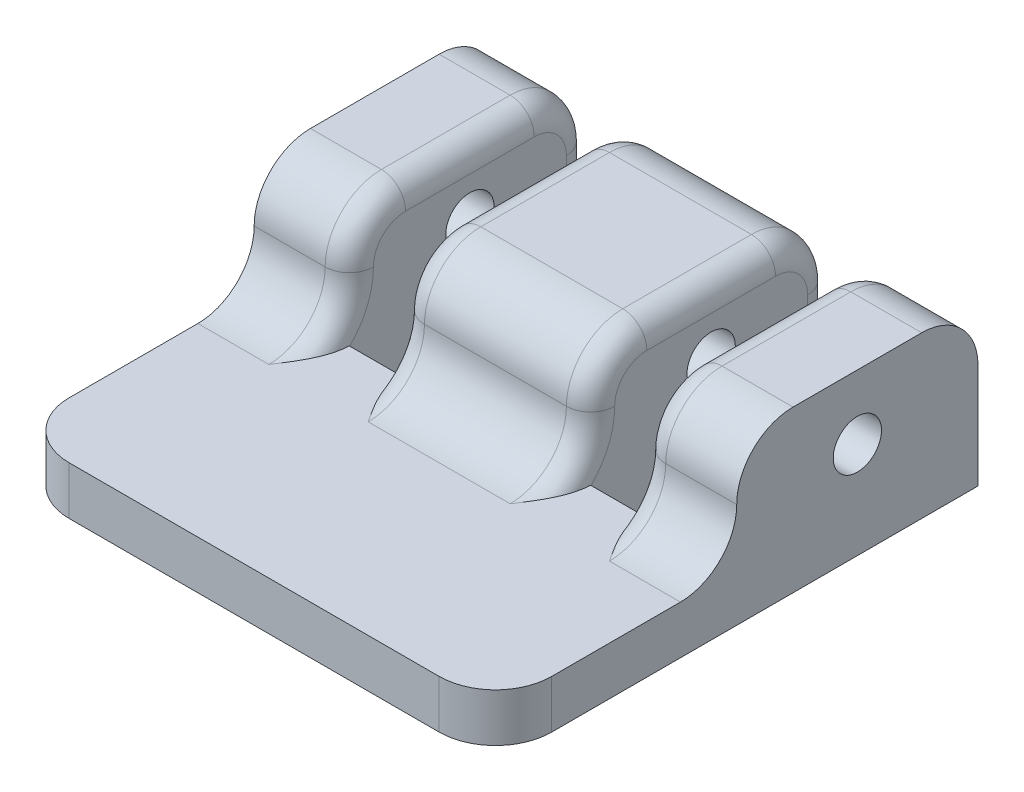
from build123d import *

# Parameters (mm, degrees)
BOSS_EXTRUDE1_DEPTH = 30
SKETCH2_R           = 1.5
CUT_EXTRUDE1_DEPTH  = 44.588989435
CUT_EXTRUDE2_REACH  = 45.589
SKETCH3_W           = 3.175
SKETCH3_H           = 10
FILLET1_R           = 3.5
FILLET2_R           = 1.5


# Some blends are built 0.0001 mm under size
with BuildPart() as part:
    # Sketch1 → Boss-Extrude1 (new body)
    with BuildSketch(Plane(origin=(0, 0, 0), x_dir=(0, 0, -1), z_dir=(1, 0, 0))):
        Polygon((0, 0), (-30, 0), (-30, 3), (-15, 3), (-15, 10), (0, 10), align=None)
    extrude(amount=BOSS_EXTRUDE1_DEPTH)

    # Sketch2 → Cut-Extrude1 (cut, through all)
    with BuildSketch(Plane(origin=(30, 0, 0), x_dir=(0, 0, -1), z_dir=(1, 0, 0))):
        with Locations((-7.5, 6)):
            Circle(SKETCH2_R)
    extrude(amount=-CUT_EXTRUDE1_DEPTH, mode=Mode.SUBTRACT)

    # Cut-Extrude2: up to this face of the body (flat: up to its plane)
    cut_extrude2_end = Plane(part.part.faces().sort_by_distance((15, 6.5, 15))[0])
    # Sketch3 → Cut-Extrude2 (cut, up to the picked face)
    with BuildSketch(Plane(origin=(0, 0, 0), x_dir=(-1, 0, 0), z_dir=(0, 0, -1)), mode=Mode.PRIVATE) as cut_extrude2_sk1:
        with Locations((-7.5, 5)):
            Rectangle(SKETCH3_W, SKETCH3_H)
    cut_extrude2_tool1 = split(extrude(cut_extrude2_sk1.sketch, amount=-CUT_EXTRUDE2_REACH, mode=Mode.PRIVATE), bisect_by=cut_extrude2_end, keep=Keep.BOTH, mode=Mode.PRIVATE)
    # Sketch3 → Cut-Extrude2 (cut, up to the picked face)
    with BuildSketch(Plane(origin=(0, 0, 0), x_dir=(-1, 0, 0), z_dir=(0, 0, -1)), mode=Mode.PRIVATE) as cut_extrude2_sk2:
        with Locations((-22.5, 5)):
            Rectangle(SKETCH3_W, SKETCH3_H)
    cut_extrude2_tool2 = split(extrude(cut_extrude2_sk2.sketch, amount=-CUT_EXTRUDE2_REACH, mode=Mode.PRIVATE), bisect_by=cut_extrude2_end, keep=Keep.BOTH, mode=Mode.PRIVATE)
    add(cut_extrude2_tool1.solids().sort_by(Axis((7.5, 5, 0), (0, 0, 1)))[0], mode=Mode.SUBTRACT)
    add(cut_extrude2_tool2.solids().sort_by(Axis((22.5, 5, 0), (0, 0, 1)))[0], mode=Mode.SUBTRACT)

    # Fillet1
    fillet1_edges = [part.edges().sort_by_distance(p)[0] for p in [
        (0, 1.5, 30),
        (30, 1.5, 30),
        (15, 10, 0),
        (15, 3, 15),
        (15, 10, 15),
        (2.95625, 10, 0),
        (27.04375, 10, 0),
        (2.95625, 10, 15),
        (27.04375, 10, 15),
        (27.04375, 3, 15),
        (2.95625, 3, 15),
    ]]
    fillet(fillet1_edges, radius=FILLET1_R - 0.0001)  # a hair under: the kernel refuses the full size

    # Fillet2
    # the kernel refuses this fillet: 1.5 mm, written as the material it takes off along each edge
    with BuildSketch(Plane(origin=(5.9125, 6.4999, 18.4999), x_dir=(0, -0.4784658161489802, 0.87810617967128), z_dir=(0, 0.87810617967128, 0.4784658161489802))) as fillet2_piece_1_section:
        with BuildLine():
            CenterArc((3.4999 + FILLET2_R, -FILLET2_R), FILLET2_R, 90, 90)
            Line((3.4999, -FILLET2_R), (3.4999, 0))
            Line((3.4999, 0), (3.4999 + FILLET2_R, 0))
        make_face()
    fillet2_piece_1 = revolve(axis=Axis((5.9125, 6.4999, 18.4999), (1, 0, 0)), revolution_arc=151.414750095, mode=Mode.PRIVATE)
    fillet2_piece_1 = split(fillet2_piece_1, bisect_by=Plane(origin=(5.513661533, 3, 15.961303767), z_dir=(0, 1, 0)), keep=Keep.TOP, mode=Mode.PRIVATE)
    add(fillet2_piece_1, mode=Mode.SUBTRACT)
    with BuildSketch(Plane(origin=(5.9125, 6.4999, 18.4999), x_dir=(0, -0.4784658161489802, 0.87810617967128), z_dir=(0, 0.87810617967128, 0.4784658161489802))) as fillet2_piece_2_section:
        with BuildLine():
            CenterArc((3.4999 + FILLET2_R, -FILLET2_R), FILLET2_R, 90, 90)
            Line((3.4999, -FILLET2_R), (3.4999, 0))
            Line((3.4999, 0), (3.4999 + FILLET2_R, 0))
        make_face()
    fillet2_piece_2 = revolve(axis=Axis((5.9125, 6.4999, 18.4999), (1, 0, 0)), revolution_arc=151.414750095, mode=Mode.PRIVATE)
    fillet2_piece_2 = split(fillet2_piece_2, bisect_by=Plane(origin=(5.912331241, 2.985794163, 15), z_dir=(0, 0, -1)), keep=Keep.TOP, mode=Mode.PRIVATE)
    add(fillet2_piece_2, mode=Mode.SUBTRACT)
    with BuildSketch(Plane(origin=(5.9125, 6.5001, 11.5001), x_dir=(0, 1, 0), z_dir=(0, 0, -1))) as fillet2_piece_3:
        with BuildLine():
            CenterArc((3.4999 - FILLET2_R, -FILLET2_R), FILLET2_R, 360, 90)
            Line((3.4999, -FILLET2_R), (3.4999, 0))
            Line((3.4999, 0), (3.4999 - FILLET2_R, 0))
        make_face()
    revolve(axis=Axis((5.9125, 6.5001, 11.5001), (1, 0, 0)), revolution_arc=90, mode=Mode.SUBTRACT)
    with BuildSketch(Plane(origin=(5.9125, 6.5001, 0), x_dir=(-1, 0, 0), z_dir=(0, -1, 0)), Plane(origin=(24.0875, -3.75, 0), x_dir=(1, 0, 0), z_dir=(0, 1, 0)), Plane(origin=(20.9125, 6.5001, 0), x_dir=(-1, 0, 0), z_dir=(0, -1, 0))) as fillet2_piece_4:
        with BuildLine():
            CenterArc((FILLET2_R, -FILLET2_R), FILLET2_R, 90, 90)
            Line((0, -FILLET2_R), (0, 0))
            Line((0, 0), (FILLET2_R, 0))
        make_face()
    extrude(amount=10.2501, mode=Mode.SUBTRACT)
    with BuildSketch(Plane(origin=(5.9125, 6.5001, 3.4999), x_dir=(0, 0, -1), z_dir=(0, -1, 0))) as fillet2_piece_5:
        with BuildLine():
            CenterArc((3.4999 - FILLET2_R, -FILLET2_R), FILLET2_R, 0, 90)
            Line((3.4999, -FILLET2_R), (3.4999, 0))
            Line((3.4999, 0), (3.4999 - FILLET2_R, 0))
        make_face()
    revolve(axis=Axis((5.9125, 6.5001, 3.4999), (1, 0, 0)), revolution_arc=90, mode=Mode.SUBTRACT)
    with BuildSketch(Plane(origin=(9.0875, 6.4999, 18.4999), x_dir=(0, -0.478465816148981, 0.8781061796712796), z_dir=(0, 0.8781061796712796, 0.478465816148981))) as fillet2_piece_6_section:
        with BuildLine():
            CenterArc((3.4999 + FILLET2_R, FILLET2_R), FILLET2_R, 180, 90)
            Line((3.4999, FILLET2_R), (3.4999, 0))
            Line((3.4999, 0), (3.4999 + FILLET2_R, 0))
        make_face()
    fillet2_piece_6 = revolve(axis=Axis((9.0875, 6.4999, 18.4999), (1, 0, 0)), revolution_arc=151.414750095, mode=Mode.PRIVATE)
    fillet2_piece_6 = split(fillet2_piece_6, bisect_by=Plane(origin=(9.486338509, 3, 15.961303608), z_dir=(0, 1, 0)), keep=Keep.TOP, mode=Mode.PRIVATE)
    add(fillet2_piece_6, mode=Mode.SUBTRACT)
    with BuildSketch(Plane(origin=(9.0875, 6.4999, 18.4999), x_dir=(0, -0.478465816148981, 0.8781061796712796), z_dir=(0, 0.8781061796712796, 0.478465816148981))) as fillet2_piece_7_section:
        with BuildLine():
            CenterArc((3.4999 + FILLET2_R, FILLET2_R), FILLET2_R, 180, 90)
            Line((3.4999, FILLET2_R), (3.4999, 0))
            Line((3.4999, 0), (3.4999 + FILLET2_R, 0))
        make_face()
    fillet2_piece_7 = revolve(axis=Axis((9.0875, 6.4999, 18.4999), (1, 0, 0)), revolution_arc=151.414750095, mode=Mode.PRIVATE)
    fillet2_piece_7 = split(fillet2_piece_7, bisect_by=Plane(origin=(9.087668759, 2.985794163, 15), z_dir=(0, 0, -1)), keep=Keep.TOP, mode=Mode.PRIVATE)
    add(fillet2_piece_7, mode=Mode.SUBTRACT)
    with BuildSketch(Plane(origin=(9.0875, 6.5001, 11.5001), x_dir=(0, 1, 0), z_dir=(0, 0, -1))) as fillet2_piece_8:
        with BuildLine():
            CenterArc((3.4999 - FILLET2_R, FILLET2_R), FILLET2_R, 270, 90)
            Line((3.4999, FILLET2_R), (3.4999, 0))
            Line((3.4999, 0), (3.4999 - FILLET2_R, 0))
        make_face()
    revolve(axis=Axis((9.0875, 6.5001, 11.5001), (1, 0, 0)), revolution_arc=90, mode=Mode.SUBTRACT)
    with BuildSketch(Plane(origin=(9.0875, -3.75, 0), x_dir=(0, 0, 1), z_dir=(0, 1, 0))) as fillet2_piece_9:
        with BuildLine():
            CenterArc((FILLET2_R, FILLET2_R), FILLET2_R, 180, 90)
            Line((0, FILLET2_R), (0, 0))
            Line((0, 0), (FILLET2_R, 0))
        make_face()
    extrude(amount=10.2501, mode=Mode.SUBTRACT)
    with BuildSketch(Plane(origin=(9.0875, 6.5001, 3.4999), x_dir=(0, 0, -1), z_dir=(0, -1, 0))) as fillet2_piece_10:
        with BuildLine():
            CenterArc((3.4999 - FILLET2_R, FILLET2_R), FILLET2_R, 270, 90)
            Line((3.4999, FILLET2_R), (3.4999, 0))
            Line((3.4999, 0), (3.4999 - FILLET2_R, 0))
        make_face()
    revolve(axis=Axis((9.0875, 6.5001, 3.4999), (1, 0, 0)), revolution_arc=90, mode=Mode.SUBTRACT)
    with BuildSketch(Plane(origin=(24.0875, 6.4999, 18.4999), x_dir=(0, -0.478465816148981, 0.8781061796712796), z_dir=(0, 0.8781061796712796, 0.478465816148981))) as fillet2_piece_11_section:
        with BuildLine():
            CenterArc((3.4999 + FILLET2_R, FILLET2_R), FILLET2_R, 180, 90)
            Line((3.4999, FILLET2_R), (3.4999, 0))
            Line((3.4999, 0), (3.4999 + FILLET2_R, 0))
        make_face()
    fillet2_piece_11 = revolve(axis=Axis((24.0875, 6.4999, 18.4999), (1, 0, 0)), revolution_arc=151.414750095, mode=Mode.PRIVATE)
    fillet2_piece_11 = split(fillet2_piece_11, bisect_by=Plane(origin=(24.486338467, 3, 15.961303767), z_dir=(0, 1, 0)), keep=Keep.TOP, mode=Mode.PRIVATE)
    add(fillet2_piece_11, mode=Mode.SUBTRACT)
    with BuildSketch(Plane(origin=(24.0875, 6.4999, 18.4999), x_dir=(0, -0.478465816148981, 0.8781061796712796), z_dir=(0, 0.8781061796712796, 0.478465816148981))) as fillet2_piece_12_section:
        with BuildLine():
            CenterArc((3.4999 + FILLET2_R, FILLET2_R), FILLET2_R, 180, 90)
            Line((3.4999, FILLET2_R), (3.4999, 0))
            Line((3.4999, 0), (3.4999 + FILLET2_R, 0))
        make_face()
    fillet2_piece_12 = revolve(axis=Axis((24.0875, 6.4999, 18.4999), (1, 0, 0)), revolution_arc=151.414750095, mode=Mode.PRIVATE)
    fillet2_piece_12 = split(fillet2_piece_12, bisect_by=Plane(origin=(24.087668759, 2.985794163, 15), z_dir=(0, 0, -1)), keep=Keep.TOP, mode=Mode.PRIVATE)
    add(fillet2_piece_12, mode=Mode.SUBTRACT)
    with BuildSketch(Plane(origin=(24.0875, 6.5001, 11.5001), x_dir=(0, 1, 0), z_dir=(0, 0, -1))) as fillet2_piece_13:
        with BuildLine():
            CenterArc((3.4999 - FILLET2_R, FILLET2_R), FILLET2_R, 270, 90)
            Line((3.4999, FILLET2_R), (3.4999, 0))
            Line((3.4999, 0), (3.4999 - FILLET2_R, 0))
        make_face()
    revolve(axis=Axis((24.0875, 6.5001, 11.5001), (1, 0, 0)), revolution_arc=90, mode=Mode.SUBTRACT)
    with BuildSketch(Plane(origin=(24.0875, 6.5001, 3.4999), x_dir=(0, 0, -1), z_dir=(0, -1, 0))) as fillet2_piece_14:
        with BuildLine():
            CenterArc((3.4999 - FILLET2_R, FILLET2_R), FILLET2_R, 270, 90)
            Line((3.4999, FILLET2_R), (3.4999, 0))
            Line((3.4999, 0), (3.4999 - FILLET2_R, 0))
        make_face()
    revolve(axis=Axis((24.0875, 6.5001, 3.4999), (1, 0, 0)), revolution_arc=90, mode=Mode.SUBTRACT)
    with BuildSketch(Plane(origin=(20.9125, 6.4999, 18.4999), x_dir=(0, -0.478465816148981, 0.8781061796712796), z_dir=(0, 0.8781061796712796, 0.478465816148981))) as fillet2_piece_15_section:
        with BuildLine():
            CenterArc((3.4999 + FILLET2_R, -FILLET2_R), FILLET2_R, 90, 90)
            Line((3.4999, -FILLET2_R), (3.4999, 0))
            Line((3.4999, 0), (3.4999 + FILLET2_R, 0))
        make_face()
    fillet2_piece_15 = revolve(axis=Axis((20.9125, 6.4999, 18.4999), (1, 0, 0)), revolution_arc=151.414750095, mode=Mode.PRIVATE)
    fillet2_piece_15 = split(fillet2_piece_15, bisect_by=Plane(origin=(20.513661491, 3, 15.961303608), z_dir=(0, 1, 0)), keep=Keep.TOP, mode=Mode.PRIVATE)
    add(fillet2_piece_15, mode=Mode.SUBTRACT)
    with BuildSketch(Plane(origin=(20.9125, 6.4999, 18.4999), x_dir=(0, -0.478465816148981, 0.8781061796712796), z_dir=(0, 0.8781061796712796, 0.478465816148981))) as fillet2_piece_16_section:
        with BuildLine():
            CenterArc((3.4999 + FILLET2_R, -FILLET2_R), FILLET2_R, 90, 90)
            Line((3.4999, -FILLET2_R), (3.4999, 0))
            Line((3.4999, 0), (3.4999 + FILLET2_R, 0))
        make_face()
    fillet2_piece_16 = revolve(axis=Axis((20.9125, 6.4999, 18.4999), (1, 0, 0)), revolution_arc=151.414750095, mode=Mode.PRIVATE)
    fillet2_piece_16 = split(fillet2_piece_16, bisect_by=Plane(origin=(20.912331241, 2.985794163, 15), z_dir=(0, 0, -1)), keep=Keep.TOP, mode=Mode.PRIVATE)
    add(fillet2_piece_16, mode=Mode.SUBTRACT)
    with BuildSketch(Plane(origin=(20.9125, 6.5001, 11.5001), x_dir=(0, 1, 0), z_dir=(0, 0, -1))) as fillet2_piece_17:
        with BuildLine():
            CenterArc((3.4999 - FILLET2_R, -FILLET2_R), FILLET2_R, 0, 90)
            Line((3.4999, -FILLET2_R), (3.4999, 0))
            Line((3.4999, 0), (3.4999 - FILLET2_R, 0))
        make_face()
    revolve(axis=Axis((20.9125, 6.5001, 11.5001), (1, 0, 0)), revolution_arc=90, mode=Mode.SUBTRACT)
    with BuildSketch(Plane(origin=(20.9125, 6.5001, 3.4999), x_dir=(0, 0, -1), z_dir=(0, -1, 0))) as fillet2_piece_18:
        with BuildLine():
            CenterArc((3.4999 - FILLET2_R, -FILLET2_R), FILLET2_R, 0, 90)
            Line((3.4999, -FILLET2_R), (3.4999, 0))
            Line((3.4999, 0), (3.4999 - FILLET2_R, 0))
        make_face()
    revolve(axis=Axis((20.9125, 6.5001, 3.4999), (1, 0, 0)), revolution_arc=90, mode=Mode.SUBTRACT)
    with BuildSketch(Plane(origin=(5.9125, 10, 3.4999), x_dir=(0, -1, 0), z_dir=(0, 0, 1)), Plane(origin=(20.9125, 10, 3.4999), x_dir=(0, -1, 0), z_dir=(0, 0, 1))) as fillet2_piece_19:
        with BuildLine():
            CenterArc((FILLET2_R, -FILLET2_R), FILLET2_R, 90, 90)
            Line((0, -FILLET2_R), (0, 0))
            Line((0, 0), (FILLET2_R, 0))
        make_face()
    extrude(amount=8.0002, mode=Mode.SUBTRACT)
    with BuildSketch(Plane(origin=(9.0875, 10, 3.4999), x_dir=(0, -1, 0), z_dir=(0, 0, 1)), Plane(origin=(24.0875, 10, 3.4999), x_dir=(0, -1, 0), z_dir=(0, 0, 1))) as fillet2_piece_20:
        with BuildLine():
            CenterArc((FILLET2_R, FILLET2_R), FILLET2_R, 180, 90)
            Line((0, FILLET2_R), (0, 0))
            Line((0, 0), (FILLET2_R, 0))
        make_face()
    extrude(amount=8.0002, mode=Mode.SUBTRACT)
    with BuildSketch(Plane(origin=(20.9125, 6.5001, 15), x_dir=(0, 0, -1), z_dir=(0, -1, 0)), Plane(origin=(24.0875, 6.4999, 15), x_dir=(0, 0, -1), z_dir=(0, 1, 0)), Plane(origin=(9.0875, 6.4999, 15), x_dir=(0, 0, -1), z_dir=(0, 1, 0)), Plane(origin=(5.9125, 6.5001, 15), x_dir=(0, 0, -1), z_dir=(0, -1, 0))) as fillet2_piece_21:
        with BuildLine():
            CenterArc((FILLET2_R, -FILLET2_R), FILLET2_R, 90, 90)
            Line((0, -FILLET2_R), (0, 0))
            Line((0, 0), (FILLET2_R, 0))
        make_face()
    extrude(amount=0.0002, mode=Mode.SUBTRACT)


solid = part.part
